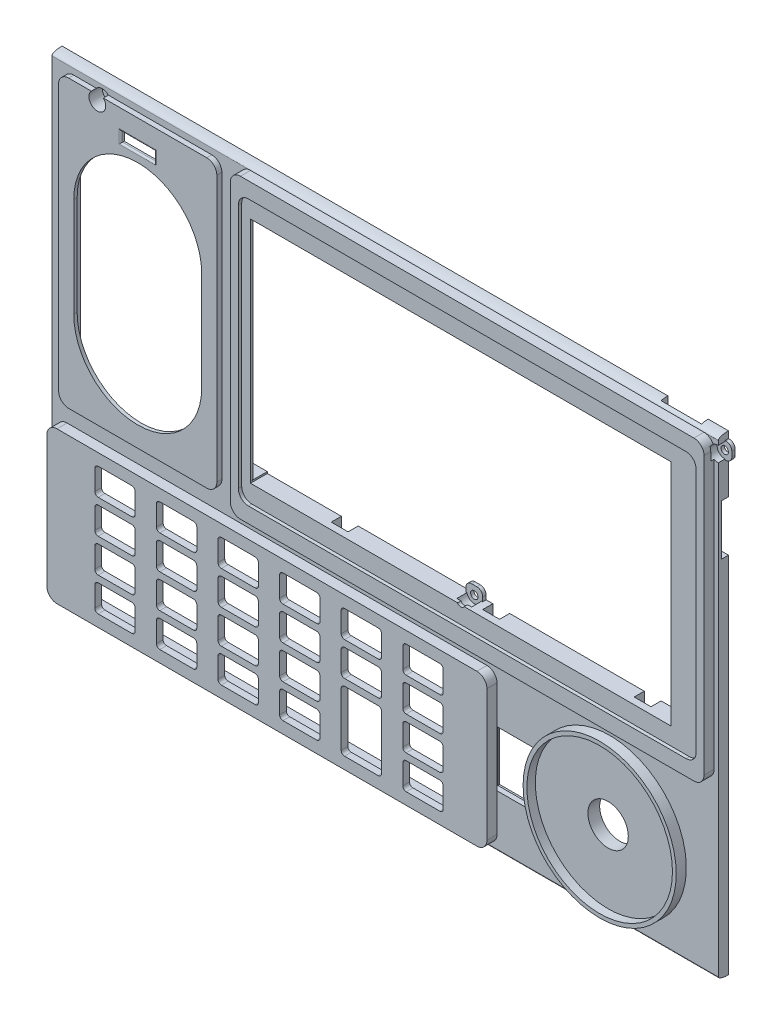
from build123d import *

# Parameters (mm, degrees)
SKETCH1_W                      = 198
SKETCH1_H                      = 140
MAIN_BODY_DEPTH                = 3
LONG_CORNERS_SIZE              = 3
LONG_CORNERS_SIZE_2            = 1
SKETCH2_W                      = 47
SKETCH2_H                      = 85
SPEAKER_DEPTH                  = 1.5
SPEAKER_CORNERS_R              = 3
SPEAKER_CUT_DEPTH              = 122.331158548
SKETCH21_W                     = 43
SKETCH21_H                     = 78
SPEAKER_SLOT_DEPTH             = 3.5
SKETCH3_W                      = 140.75
SKETCH3_H                      = 88.25
LCD_DEPTH                      = 3
LCD_CORNERS_R                  = 3
SKETCH9_W                      = 136
SKETCH9_H                      = 79
LCD_FRONT_DEPTH                = 1
LCD_FRONT_CORNERS_R            = 3
SKETCH10_W                     = 125
SKETCH10_H                     = 68
LCD_BACK_DEPTH                 = 122.396046203
SKETCH56_W                     = 5
SKETCH56_H                     = 3
SKETCH56_W_2                   = 4
SKETCH56_H_2                   = 67
LCD_GLUE_POINTS_DEPTH          = 3
SKETCH4_W                      = 130.75
SKETCH4_H                      = 45
KEYPAD_DEPTH                   = 3
KEYPAD_CORNERS_R               = 3
SKETCH25_W                     = 12
SKETCH25_H                     = 8
SKETCH25_H_2                   = 18
KEYPAD_CUTS_0_8_DEPTH          = 122.396046208
SKETCH5_R                      = 22.75
VFO_DEPTH                      = 3
SKETCH7_R                      = 6
VFO_ENCODER_KNOB_CUT_DEPTH     = 122.396046208
ESP32_W                        = 18.5
ESP32_H                        = 16.5
ESP32_CAN_CUT_DEPTH            = 3
SKETCH47_W                     = 27
SKETCH47_H                     = 18.5
ESP32_EX_CUT_DEPTH             = 1.5
SKETCH49_W                     = 10
SKETCH49_H                     = 3
AMB_SENSOR_DEPTH               = 122.396046203
AMB_CORNERS_R                  = 0.5
SKETCH55_R                     = 3
SKETCH55_W                     = 12
SKETCH55_H                     = 11.5
SKETCH55_W_2                   = 4.5
SKETCH55_H_2                   = 15
SKETCH55_W_3                   = 6
CONN_CUTOUTS_DEPTH             = 2
FILLET1_R                      = 2
FILLET2_R                      = 5
SKETCH57_W                     = 113
SKETCH57_H                     = 42
KEYBOARD_BACK_DEPTH            = 4
SKETCH58_W                     = 5
SKETCH58_H                     = 1
BEHIND_LCD_SCREEW_MOUNT_DEPTH  = 3
SKETCH59_W                     = 1
SKETCH59_H                     = 3
KEYB_SCREW_MOUNT_DEPTH         = 1
SKETCH60_W                     = 1
SKETCH60_H                     = 5
RIGHT_CORNER_SCREW_MOUNT_DEPTH = 2
SKETCH61_R                     = 1.1
UI_SCREWS_DEPTH                = 124.032516084
UI_SCREW_HEAD_START            = -2
SKETCH62_R                     = 2.25
UI_SCREW_HEAD_DEPTH            = 3
UI_SCREW_MOUNT_CORNERS_R       = 1.75
SKETCH63_R                     = 21.625
ENC_KNOB_SLOT_DEPTH            = 2.5
SKETCH64_R                     = 2.5
ON_SPEAKER_UI_SCREW_HEAD_DEPTH = 4
FILLET3_R                      = 2
FILLET4_R                      = 1


# Some blends are built 0.0001 mm under size
with BuildPart() as part:
    # Sketch1 → main_body (new body)
    with BuildSketch(Plane.XY):
        Rectangle(SKETCH1_W, SKETCH1_H)
    extrude(amount=MAIN_BODY_DEPTH)

    # long_corners
    # an asymmetric fillet: 3, 1 mm, written as the material it takes off along each edge
    with BuildSketch(Plane(origin=(-106.5, 70, 3), x_dir=(0, 0, -1), z_dir=(1, 0, 0)), Plane(origin=(106.5, -70, 3), x_dir=(0, 0, -1), z_dir=(-1, 0, 0))) as long_corners_piece_1:
        with BuildLine():
            Bezier((LONG_CORNERS_SIZE, 0), (0, 0), (0, -LONG_CORNERS_SIZE_2), weights=[1, 0.707106781, 1])
            Line((0, -LONG_CORNERS_SIZE_2), (0, 0))
            Line((0, 0), (LONG_CORNERS_SIZE, 0))
        make_face()
    extrude(amount=213, mode=Mode.SUBTRACT)

    # Sketch2 → speaker (add)
    with BuildSketch(Plane.XY.offset(3)):
        with Locations((-72, 24.75)):
            Rectangle(SKETCH2_W, SKETCH2_H)
    extrude(amount=SPEAKER_DEPTH)

    # speaker_corners
    speaker_corners_edges = [part.edges().sort_by_distance(p)[0] for p in [
        (-95.5, 67.25, 3.75),
        (-95.5, -17.75, 3.75),
        (-48.5, -17.75, 3.75),
        (-48.5, 67.25, 3.75),
    ]]
    fillet(speaker_corners_edges, radius=SPEAKER_CORNERS_R)

    # Sketch19 → speaker_cut (cut, through all)
    with BuildSketch(Plane.XY.offset(4.5)):
        with BuildLine():
            Line((-91, 7.25), (-91, 36.75))
            ThreePointArc((-91, 36.75), (-72, 55.75), (-53, 36.75))
            Line((-53, 36.75), (-53, 7.25))
            ThreePointArc((-53, 7.25), (-72, -11.75), (-91, 7.25))
        make_face()
    extrude(amount=-SPEAKER_CUT_DEPTH, mode=Mode.SUBTRACT)

    # Sketch21 → speaker_slot (cut)
    with BuildSketch(Plane(origin=(0, 0, 0), x_dir=(-1, 0, 0), z_dir=(0, 0, -1))):
        with Locations((72, 22)):
            Rectangle(SKETCH21_W, SKETCH21_H)
    extrude(amount=-SPEAKER_SLOT_DEPTH, mode=Mode.SUBTRACT)

    # Sketch3 → lcd (add)
    with BuildSketch(Plane.XY.offset(3)):
        with Locations((27.375, 24.875)):
            Rectangle(SKETCH3_W, SKETCH3_H)
    extrude(amount=LCD_DEPTH)

    # lcd_corners
    lcd_corners_edges = [part.edges().sort_by_distance(p)[0] for p in [
        (97.75, -19.25, 4.5),
        (-43, -19.25, 4.5),
        (97.75, 69, 4.5),
        (-43, 69, 4.5),
    ]]
    fillet(lcd_corners_edges, radius=LCD_CORNERS_R)

    # Sketch9 → lcd_front (cut)
    with BuildSketch(Plane.XY.offset(6)):
        with Locations((27.4, 24.85)):
            Rectangle(SKETCH9_W, SKETCH9_H)
    extrude(amount=-LCD_FRONT_DEPTH, mode=Mode.SUBTRACT)

    # lcd_front_corners
    lcd_front_corners_edges = [part.edges().sort_by_distance(p)[0] for p in [
        (-40.6, -14.65, 5.5),
        (-40.6, 64.35, 5.5),
        (95.4, 64.35, 5.5),
        (95.4, -14.65, 5.5),
    ]]
    fillet(lcd_front_corners_edges, radius=LCD_FRONT_CORNERS_R)

    # Sketch10 → lcd_back (cut, through all)
    with BuildSketch(Plane(origin=(0, 0, 0), x_dir=(-1, 0, 0), z_dir=(0, 0, -1))):
        with Locations((-24.5, 24.5)):
            Rectangle(SKETCH10_W, SKETCH10_H)
    extrude(amount=-LCD_BACK_DEPTH, mode=Mode.SUBTRACT)

    # Sketch56 → lcd_glue_points (cut)
    with BuildSketch(Plane(origin=(0, 0, 0), x_dir=(-1, 0, 0), z_dir=(0, 0, -1))):
        with Locations((-76.5, -11)):
            Rectangle(SKETCH56_W, SKETCH56_H)
        with Locations((-31.5, -11)):
            Rectangle(SKETCH56_W, SKETCH56_H)
        with Locations((13.5, -11)):
            Rectangle(SKETCH56_W, SKETCH56_H)
        with Locations((-76.5, 60)):
            Rectangle(SKETCH56_W, SKETCH56_H)
        with Locations((-31.5, 60)):
            Rectangle(SKETCH56_W, SKETCH56_H)
        with Locations((13.5, 60)):
            Rectangle(SKETCH56_W, SKETCH56_H)
        with Locations((40, 24.5)):
            Rectangle(SKETCH56_W_2, SKETCH56_H_2)
    extrude(amount=-LCD_GLUE_POINTS_DEPTH, mode=Mode.SUBTRACT)

    # Sketch4 → keypad (add)
    with BuildSketch(Plane.XY.offset(3)):
        with Locations((-32.125, -45.75)):
            Rectangle(SKETCH4_W, SKETCH4_H)
    extrude(amount=KEYPAD_DEPTH)

    # keypad_corners
    keypad_corners_edges = [part.edges().sort_by_distance(p)[0] for p in [
        (-97.5, -23.25, 4.5),
        (-97.5, -68.25, 4.5),
        (33.25, -68.25, 4.5),
        (33.25, -23.25, 4.5),
    ]]
    fillet(keypad_corners_edges, radius=KEYPAD_CORNERS_R)

    # Sketch25 → keypad_cuts_0.8 (cut, through all)
    with BuildSketch(Plane.XY.offset(6)):
        with Locations((-77.25, -30.75)):
            Rectangle(SKETCH25_W, SKETCH25_H)
        with Locations((-77.25, -40.75)):
            Rectangle(SKETCH25_W, SKETCH25_H)
        with Locations((-77.25, -50.75)):
            Rectangle(SKETCH25_W, SKETCH25_H)
        with Locations((-77.25, -60.75)):
            Rectangle(SKETCH25_W, SKETCH25_H)
        with Locations((-58.95, -30.75)):
            Rectangle(SKETCH25_W, SKETCH25_H)
        with Locations((-58.95, -40.75)):
            Rectangle(SKETCH25_W, SKETCH25_H)
        with Locations((-58.95, -50.75)):
            Rectangle(SKETCH25_W, SKETCH25_H)
        with Locations((-58.95, -60.75)):
            Rectangle(SKETCH25_W, SKETCH25_H)
        with Locations((-40.65, -30.75)):
            Rectangle(SKETCH25_W, SKETCH25_H)
        with Locations((-40.65, -40.75)):
            Rectangle(SKETCH25_W, SKETCH25_H)
        with Locations((-40.65, -50.75)):
            Rectangle(SKETCH25_W, SKETCH25_H)
        with Locations((-40.65, -60.75)):
            Rectangle(SKETCH25_W, SKETCH25_H)
        with Locations((-22.35, -30.75)):
            Rectangle(SKETCH25_W, SKETCH25_H)
        with Locations((-22.35, -40.75)):
            Rectangle(SKETCH25_W, SKETCH25_H)
        with Locations((-22.35, -50.75)):
            Rectangle(SKETCH25_W, SKETCH25_H)
        with Locations((-22.35, -60.75)):
            Rectangle(SKETCH25_W, SKETCH25_H)
        with Locations((-4.05, -30.75)):
            Rectangle(SKETCH25_W, SKETCH25_H)
        with Locations((14.25, -30.75)):
            Rectangle(SKETCH25_W, SKETCH25_H)
        with Locations((-4.05, -40.75)):
            Rectangle(SKETCH25_W, SKETCH25_H)
        with Locations((14.25, -40.75)):
            Rectangle(SKETCH25_W, SKETCH25_H)
        with Locations((14.25, -50.75)):
            Rectangle(SKETCH25_W, SKETCH25_H)
        with Locations((14.25, -60.75)):
            Rectangle(SKETCH25_W, SKETCH25_H)
        with Locations((-4.05, -55.75)):
            Rectangle(SKETCH25_W, SKETCH25_H_2)
    extrude(amount=-KEYPAD_CUTS_0_8_DEPTH, mode=Mode.SUBTRACT)

    # Sketch5 → vfo (add)
    with BuildSketch(Plane.XY.offset(3)):
        with Locations((66.75, -45.75)):
            Circle(SKETCH5_R)
    extrude(amount=VFO_DEPTH)

    # Sketch7 → vfo_encoder_knob_cut (cut, through all)
    with BuildSketch(Plane.XY.offset(6)):
        with Locations((66.75, -45.75)):
            Circle(SKETCH7_R)
    extrude(amount=-VFO_ENCODER_KNOB_CUT_DEPTH, mode=Mode.SUBTRACT)

    # esp32 → esp32_can_cut (cut)
    with BuildSketch(Plane(origin=(0, 0, 0), x_dir=(-1, 0, 0), z_dir=(0, 0, -1))):
        with Locations((-41.25, -45.75)):
            Rectangle(ESP32_W, ESP32_H)
    extrude(amount=-ESP32_CAN_CUT_DEPTH, mode=Mode.SUBTRACT)

    # Sketch47 → esp32_ex_cut (cut)
    with BuildSketch(Plane(origin=(0, 0, 0), x_dir=(-1, 0, 0), z_dir=(0, 0, -1))):
        with Locations((-44.5, -45.75)):
            Rectangle(SKETCH47_W, SKETCH47_H)
    extrude(amount=-ESP32_EX_CUT_DEPTH, mode=Mode.SUBTRACT)

    # Sketch49 → amb_sensor (cut, through all)
    with BuildSketch(Plane(origin=(0, 0, 0), x_dir=(-1, 0, 0), z_dir=(0, 0, -1))):
        with Locations((72, 59.75)):
            Rectangle(SKETCH49_W, SKETCH49_H)
    extrude(amount=-AMB_SENSOR_DEPTH, mode=Mode.SUBTRACT)

    # amb_corners
    amb_corners_edges = [part.edges().sort_by_distance(p)[0] for p in [
        (-72, 61.25, 4.5),
        (-72, 58.25, 4.5),
        (-67, 59.75, 4.5),
        (-77, 59.75, 4.5),
    ]]
    fillet(amb_corners_edges, radius=AMB_CORNERS_R)

    # Sketch55 → conn_cutouts (cut)
    with BuildSketch(Plane(origin=(0, 0, 0), x_dir=(-1, 0, 0), z_dir=(0, 0, -1))):
        with Locations((49.5, 65.5)):
            Circle(SKETCH55_R)
        with Locations((-24.5, 65.5)):
            Circle(SKETCH55_R)
        with Locations((49.5, -8.5)):
            Circle(SKETCH55_R)
        with Locations((-68, -68)):
            Circle(SKETCH55_R)
        with Locations((-1, -68)):
            Circle(SKETCH55_R)
        with Locations((-32, 65.5)):
            Circle(SKETCH55_R)
        with Locations((-87, 64.25)):
            Rectangle(SKETCH55_W, SKETCH55_H)
        with Locations((96.75, 40.5)):
            Rectangle(SKETCH55_W_2, SKETCH55_H_2)
        with Locations((-96, 45.5)):
            Rectangle(SKETCH55_W_3, SKETCH55_H_2)
    extrude(amount=-CONN_CUTOUTS_DEPTH, mode=Mode.SUBTRACT)

    # Fillet1
    fillet1_edges = [part.edges().sort_by_distance(p)[0] for p in [
        (-38, 24.5, 3),
    ]]
    fillet(fillet1_edges, radius=FILLET1_R - 0.0001)  # a hair under: the kernel refuses the full size

    # Fillet2
    # the kernel refuses this fillet: 5 mm, written as the material it takes off along each edge
    with BuildSketch(Plane(origin=(-42, 58, 0), x_dir=(0, 0, 1), z_dir=(0, -1, 0))) as fillet2_piece_1:
        with BuildLine():
            CenterArc((5, 4.582575695), FILLET2_R, 180, 66.421821522)
            Line((0, 4.582575695), (-0.1, 4.582575695))
            Line((-0.1, 4.582575695), (-0.1, 0))
            Line((-0.1, 0), (0, -0.1))
            ThreePointArc((0, -0.1), (1.5, -0.1), (2.96, -0.091651514))
            Line((2.96, -0.091651514), (3, 0))
        make_face()
    extrude(amount=67, mode=Mode.SUBTRACT)

    # Sketch57 → keyboard_back (cut)
    with BuildSketch(Plane(origin=(0, 0, 0), x_dir=(-1, 0, 0), z_dir=(0, 0, -1))):
        with Locations((32.5, -45.5)):
            Rectangle(SKETCH57_W, SKETCH57_H)
    extrude(amount=-KEYBOARD_BACK_DEPTH, mode=Mode.SUBTRACT)

    # Sketch58 → behind_lcd_screew_mount (add)
    with BuildSketch(Plane(origin=(0, -9.5, 0), x_dir=(1, 0, 0), z_dir=(0, 1, 0))):
        with Locations((24.5, -0.5)):
            Rectangle(SKETCH58_W, SKETCH58_H)
    extrude(amount=BEHIND_LCD_SCREEW_MOUNT_DEPTH)

    # Sketch59 → keyb_screw_mount (add)
    with BuildSketch(Plane.ZY.offset(99)):
        with Locations((0.5, -68)):
            Rectangle(SKETCH59_W, SKETCH59_H)
    extrude(amount=KEYB_SCREW_MOUNT_DEPTH)

    # Sketch60 → right_corner_screw_mount (add)
    with BuildSketch(Plane(origin=(99, 0, 0), x_dir=(0, 0, -1), z_dir=(1, 0, 0))):
        with Locations((-0.5, 65.5)):
            Rectangle(SKETCH60_W, SKETCH60_H)
    extrude(amount=RIGHT_CORNER_SCREW_MOUNT_DEPTH)

    # Sketch61 → ui_screws (cut, through all)
    with BuildSketch(Plane(origin=(0, 0, 0), x_dir=(-1, 0, 0), z_dir=(0, 0, -1))):
        with Locations((-98.9, 65.5)):
            Circle(SKETCH61_R)
        with Locations((-24.5, -9)):
            Circle(SKETCH61_R)
        with Locations((98, -68)):
            Circle(SKETCH61_R)
        with Locations((84, 65.5)):
            Circle(SKETCH61_R)
    extrude(amount=-UI_SCREWS_DEPTH, mode=Mode.SUBTRACT)

    # Sketch62 → ui_screw_head (cut)
    with BuildSketch(Plane.XY.offset(6).offset(UI_SCREW_HEAD_START)):
        with Locations((24.5, -9)):
            Circle(SKETCH62_R)
        with Locations((98.9, 65.5)):
            Circle(SKETCH62_R)
        with Locations((-98, -68)):
            Circle(SKETCH62_R)
    extrude(amount=-UI_SCREW_HEAD_DEPTH, mode=Mode.SUBTRACT)

    # ui_screw_mount_corners
    # the kernel refuses this fillet: 1.75 mm, written as the material it takes off along each edge
    with BuildSketch(Plane(origin=(-100, -66.5, -3.952847075), x_dir=(0, -1, 0), z_dir=(0, 0, 1))) as ui_screw_mount_corners_piece_1:
        with BuildLine():
            CenterArc((1.58113883, 1.75), UI_SCREW_MOUNT_CORNERS_R, 205.376933525, 64.623066475)
            Line((0, 1), (-0.031622777, 0.985))
            ThreePointArc((-0.031622777, 0.985), (-0.035, 0.5), (-0.035, 0))
            Line((-0.035, 0), (0, -0.035))
            Line((0, -0.035), (1.58113883, -0.035))
            Line((1.58113883, -0.035), (1.58113883, 0))
        make_face()
    extrude(amount=8.90569415, mode=Mode.SUBTRACT)
    with BuildSketch(Plane(origin=(-100, -69.5, 4.952847075), x_dir=(1, 0, 0), z_dir=(0, 0, -1))) as ui_screw_mount_corners_piece_2:
        with BuildLine():
            CenterArc((1.75, -1.58113883), UI_SCREW_MOUNT_CORNERS_R, 115.376933525, 64.623066475)
            Line((0, -1.58113883), (-0.035, -1.58113883))
            Line((-0.035, -1.58113883), (-0.035, 0))
            Line((-0.035, 0), (0, 0.035))
            ThreePointArc((0, 0.035), (0.5, 0.035), (0.985, 0.031622777))
            Line((0.985, 0.031622777), (1, 0))
        make_face()
    extrude(amount=8.90569415, mode=Mode.SUBTRACT)
    with BuildSketch(Plane(origin=(101, 63, 5.375), x_dir=(-1, 0, 0), z_dir=(0, 0, -1)), Plane(origin=(22, -6.5, 5.375), x_dir=(1, 0, 0), z_dir=(0, 0, -1))) as ui_screw_mount_corners_piece_3:
        with BuildLine():
            CenterArc((UI_SCREW_MOUNT_CORNERS_R, UI_SCREW_MOUNT_CORNERS_R), UI_SCREW_MOUNT_CORNERS_R, 180, 90)
            Line((0, UI_SCREW_MOUNT_CORNERS_R), (-UI_SCREW_MOUNT_CORNERS_R * 0.02, UI_SCREW_MOUNT_CORNERS_R))
            Line((-UI_SCREW_MOUNT_CORNERS_R * 0.02, UI_SCREW_MOUNT_CORNERS_R), (-UI_SCREW_MOUNT_CORNERS_R * 0.02, -UI_SCREW_MOUNT_CORNERS_R * 0.02))
            Line((-UI_SCREW_MOUNT_CORNERS_R * 0.02, -UI_SCREW_MOUNT_CORNERS_R * 0.02), (UI_SCREW_MOUNT_CORNERS_R, -UI_SCREW_MOUNT_CORNERS_R * 0.02))
            Line((UI_SCREW_MOUNT_CORNERS_R, -UI_SCREW_MOUNT_CORNERS_R * 0.02), (UI_SCREW_MOUNT_CORNERS_R, 0))
        make_face()
    extrude(amount=9.75, mode=Mode.SUBTRACT)
    with BuildSketch(Plane(origin=(101, 68, -4.375), x_dir=(0, -1, 0), z_dir=(0, 0, 1)), Plane(origin=(27, -6.5, -4.375), x_dir=(0, -1, 0), z_dir=(0, 0, 1))) as ui_screw_mount_corners_piece_4:
        with BuildLine():
            CenterArc((UI_SCREW_MOUNT_CORNERS_R, -UI_SCREW_MOUNT_CORNERS_R), UI_SCREW_MOUNT_CORNERS_R, 90, 90)
            Line((0, -UI_SCREW_MOUNT_CORNERS_R), (-UI_SCREW_MOUNT_CORNERS_R * 0.02, -UI_SCREW_MOUNT_CORNERS_R))
            Line((-UI_SCREW_MOUNT_CORNERS_R * 0.02, -UI_SCREW_MOUNT_CORNERS_R), (-UI_SCREW_MOUNT_CORNERS_R * 0.02, UI_SCREW_MOUNT_CORNERS_R * 0.02))
            Line((-UI_SCREW_MOUNT_CORNERS_R * 0.02, UI_SCREW_MOUNT_CORNERS_R * 0.02), (UI_SCREW_MOUNT_CORNERS_R, UI_SCREW_MOUNT_CORNERS_R * 0.02))
            Line((UI_SCREW_MOUNT_CORNERS_R, UI_SCREW_MOUNT_CORNERS_R * 0.02), (UI_SCREW_MOUNT_CORNERS_R, 0))
        make_face()
    extrude(amount=9.75, mode=Mode.SUBTRACT)

    # Sketch63 → enc_knob_slot (cut)
    with BuildSketch(Plane.XY.offset(6)):
        with Locations((66.75, -45.75)):
            Circle(SKETCH63_R)
    extrude(amount=-ENC_KNOB_SLOT_DEPTH, mode=Mode.SUBTRACT)

    # Sketch64 → on_speaker_ui_screw_head (cut)
    with BuildSketch(Plane.XY.offset(4.5)):
        with Locations((-84, 65.5)):
            Circle(SKETCH64_R)
    extrude(amount=-ON_SPEAKER_UI_SCREW_HEAD_DEPTH, mode=Mode.SUBTRACT)

    # Fillet3
    fillet3_edges = [part.edges().sort_by_distance(p)[0] for p in [
        (-89, -66.5, 2),
        (24, -66.5, 2),
        (24, -24.5, 2),
        (-89, -24.5, 2),
    ]]
    fillet(fillet3_edges, radius=FILLET3_R)

    # Fillet4
    fillet4_edges = [part.edges().sort_by_distance(p)[0] for p in [
        (-71.25, -56.75, 5),
        (-83.25, -56.75, 5),
        (-83.25, -54.75, 5),
        (-71.25, -54.75, 5),
        (-71.25, -46.75, 5),
        (-83.25, -46.75, 5),
        (-83.25, -44.75, 5),
        (-71.25, -44.75, 5),
        (-71.25, -36.75, 5),
        (-83.25, -36.75, 5),
        (-46.65, -34.75, 5),
        (-34.65, -34.75, 5),
        (-34.65, -26.75, 5),
        (-46.65, -26.75, 5),
        (-64.95, -64.75, 5),
        (-52.95, -64.75, 5),
        (-52.95, -56.75, 5),
        (-64.95, -56.75, 5),
        (-64.95, -54.75, 5),
        (-52.95, -54.75, 5),
        (-52.95, -46.75, 5),
        (-64.95, -46.75, 5),
        (-64.95, -44.75, 5),
        (-52.95, -44.75, 5),
        (-52.95, -36.75, 5),
        (-64.95, -36.75, 5),
        (-10.05, -64.75, 5),
        (1.95, -64.75, 5),
        (1.95, -46.75, 5),
        (-10.05, -46.75, 5),
        (8.25, -64.75, 5),
        (20.25, -64.75, 5),
        (20.25, -56.75, 5),
        (8.25, -56.75, 5),
        (8.25, -34.75, 5),
        (20.25, -34.75, 5),
        (20.25, -26.75, 5),
        (8.25, -26.75, 5),
        (-10.05, -44.75, 5),
        (1.95, -44.75, 5),
        (1.95, -36.75, 5),
        (-10.05, -36.75, 5),
        (8.25, -44.75, 5),
        (20.25, -44.75, 5),
        (20.25, -36.75, 5),
        (8.25, -36.75, 5),
        (8.25, -54.75, 5),
        (20.25, -54.75, 5),
        (20.25, -46.75, 5),
        (8.25, -46.75, 5),
        (-83.25, -34.75, 5),
        (-71.25, -34.75, 5),
        (-71.25, -26.75, 5),
        (-83.25, -26.75, 5),
        (-28.35, -34.75, 5),
        (-16.35, -34.75, 5),
        (-16.35, -26.75, 5),
        (-28.35, -26.75, 5),
        (-46.65, -64.75, 5),
        (-34.65, -64.75, 5),
        (-34.65, -56.75, 5),
        (-46.65, -56.75, 5),
        (-46.65, -54.75, 5),
        (-34.65, -54.75, 5),
        (-34.65, -46.75, 5),
        (-46.65, -46.75, 5),
        (-46.65, -44.75, 5),
        (-34.65, -44.75, 5),
        (-34.65, -36.75, 5),
        (-46.65, -36.75, 5),
        (-10.05, -34.75, 5),
        (1.95, -34.75, 5),
        (1.95, -26.75, 5),
        (-10.05, -26.75, 5),
        (-28.35, -64.75, 5),
        (-16.35, -64.75, 5),
        (-16.35, -56.75, 5),
        (-28.35, -56.75, 5),
        (-28.35, -54.75, 5),
        (-16.35, -54.75, 5),
        (-16.35, -46.75, 5),
        (-28.35, -46.75, 5),
        (-28.35, -44.75, 5),
        (-16.35, -44.75, 5),
        (-16.35, -36.75, 5),
        (-28.35, -36.75, 5),
        (-64.95, -34.75, 5),
        (-52.95, -34.75, 5),
        (-52.95, -26.75, 5),
        (-64.95, -26.75, 5),
        (-83.25, -64.75, 5),
        (-71.25, -64.75, 5),
    ]]
    fillet(fillet4_edges, radius=FILLET4_R)


solid = part.part
